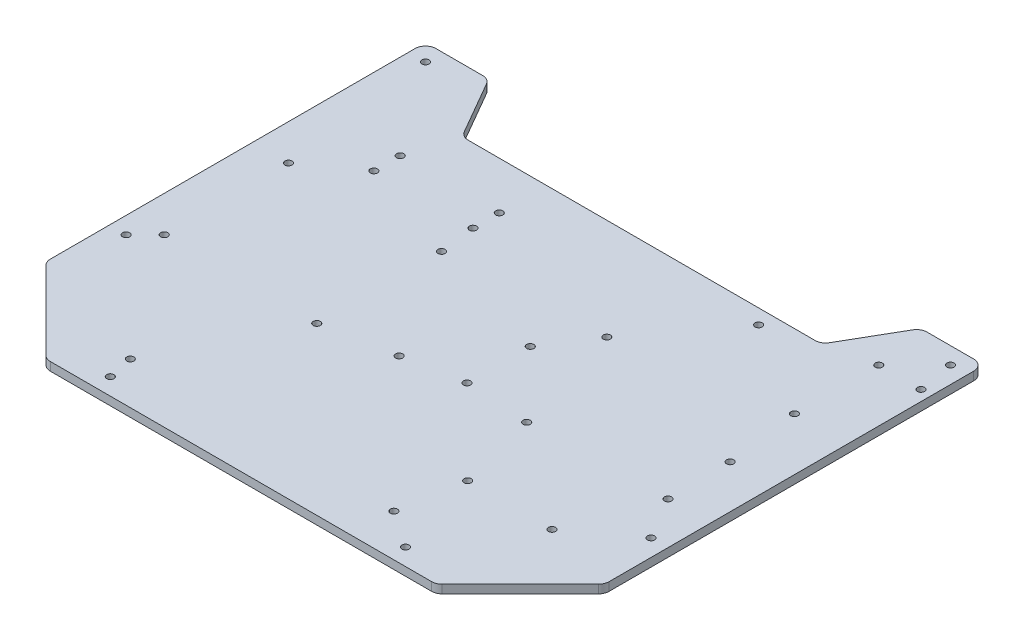
from build123d import *

# Parameters (mm, degrees)
MAIN_EXTRUSION_DEPTH    = 4
CONG_1_R                = 5
ESQUISSE1_R             = 1
ENL_V_MAT_EXTRU_1_DEPTH = 257.850637531
D_GAGEMENT_M31_D        = 3.4
ESQUISSE4_R             = 1
ENL_V_MAT_EXTRU_2_DEPTH = 257.850637531
D_GAGEMENT_M32_D        = 3.4


with BuildPart() as part:
    # Main scetch → Main extrusion (new body)
    with BuildSketch(Plane(origin=(0, 0, 0), x_dir=(1, 0, 0), z_dir=(0, 1, 0))):
        Polygon((-92.5, 0), (92.5, 0), (132.5, 40), (132.5, 220), (102.5, 220), (85.179491924, 190), (-85.179491924, 190), (-102.5, 220), (-132.5, 220), (-132.5, 40), align=None)
    extrude(amount=MAIN_EXTRUSION_DEPTH)

    # Congé1
    cong_1_edges = [part.edges().sort_by_distance(p)[0] for p in [
        (-132.5, 2, -40),
        (-92.5, 2, 0),
        (92.5, 2, 0),
        (132.5, 2, -40),
        (132.5, 2, -220),
        (102.5, 2, -220),
        (85.179491924, 2, -190),
        (-85.179491924, 2, -190),
        (-102.5, 2, -220),
        (-132.5, 2, -220),
    ]]
    fillet(cong_1_edges, radius=CONG_1_R)

    # Esquisse1 → Enlèv. mat.-Extru.1 (cut, through all)
    with BuildSketch(Plane(origin=(0, 4, 0), x_dir=(1, 0, 0), z_dir=(0, 1, 0))):
        with Locations((70, 8)):
            Circle(ESQUISSE1_R)
        with Locations((124.5, 70)):
            Circle(ESQUISSE1_R)
        with Locations((124.5, 212)):
            Circle(ESQUISSE1_R)
        with Locations((-124.5, 212)):
            Circle(ESQUISSE1_R)
        with Locations((-124.5, 70)):
            Circle(ESQUISSE1_R)
        with Locations((-70, 8)):
            Circle(ESQUISSE1_R)
    extrude(amount=-ENL_V_MAT_EXTRU_1_DEPTH, mode=Mode.SUBTRACT)

    # Dégagement M31 (through all)
    with Locations(Plane(origin=(0, 4, 0), x_dir=(1, 0, 0), z_dir=(0, 1, 0))):
        with Locations((-124.5, 212), (-124.5, 70), (-70, 8), (70, 8), (124.5, 70), (124.5, 212)):
            Hole(D_GAGEMENT_M31_D / 2)

    # Esquisse4 → Enlèv. mat.-Extru.2 (cut, through all)
    with BuildSketch(Plane(origin=(0, 4, 0), x_dir=(1, 0, 0), z_dir=(0, 1, 0))):
        with Locations((62.5, 183)):
            Circle(ESQUISSE4_R)
        with Locations((31.5, 142)):
            Circle(ESQUISSE4_R)
        with Locations((107.5, 155)):
            Circle(ESQUISSE4_R)
        with Locations((127.5, 195)):
            Circle(ESQUISSE4_R)
        with Locations((112, 120)):
            Circle(ESQUISSE4_R)
        with Locations((112.5, 90)):
            Circle(ESQUISSE4_R)
        with Locations((17.2, 120)):
            Circle(ESQUISSE4_R)
        with Locations((17.2, 90)):
            Circle(ESQUISSE4_R)
        with Locations((47.5, 88)):
            Circle(ESQUISSE4_R)
        with Locations((57.5, 50)):
            Circle(ESQUISSE4_R)
        with Locations((97.5, 50)):
            Circle(ESQUISSE4_R)
        with Locations((52.5, 20)):
            Circle(ESQUISSE4_R)
        with Locations((-10, 85)):
            Circle(ESQUISSE4_R)
        with Locations((-72.5, 20)):
            Circle(ESQUISSE4_R)
        with Locations((107.5, 195)):
            Circle(ESQUISSE4_R)
        with Locations((-115.5, 138)):
            Circle(ESQUISSE4_R)
        with Locations((-42.86, 138)):
            Circle(ESQUISSE4_R)
        with Locations((-115.5, 79.07)):
            Circle(ESQUISSE4_R)
        with Locations((-42.890430383, 78.82)):
            Circle(ESQUISSE4_R)
        with Locations((-92, 167.5)):
            Circle(ESQUISSE4_R)
        with Locations((-45, 167.5)):
            Circle(ESQUISSE4_R)
        with Locations((-92, 155)):
            Circle(ESQUISSE4_R)
        with Locations((-45, 155)):
            Circle(ESQUISSE4_R)
    extrude(amount=-ENL_V_MAT_EXTRU_2_DEPTH, mode=Mode.SUBTRACT)

    # Dégagement M32 (through all)
    with Locations(Plane(origin=(0, 4, 0), x_dir=(1, 0, 0), z_dir=(0, 1, 0))):
        with Locations((17.2, 120), (31.5, 142), (62.5, 183), (107.5, 155), (127.5, 195), (112, 120), (112.5, 90), (47.5, 88), (17.2, 90), (57.5, 50), (97.5, 50), (-10, 85), (-72.5, 20), (52.5, 20), (107.5, 195), (-115.5, 138), (-42.86, 138), (-115.5, 79.07), (-42.890430383, 78.82), (-92, 167.5), (-92, 155), (-45, 155), (-45, 167.5)):
            Hole(D_GAGEMENT_M32_D / 2)


solid = part.part
